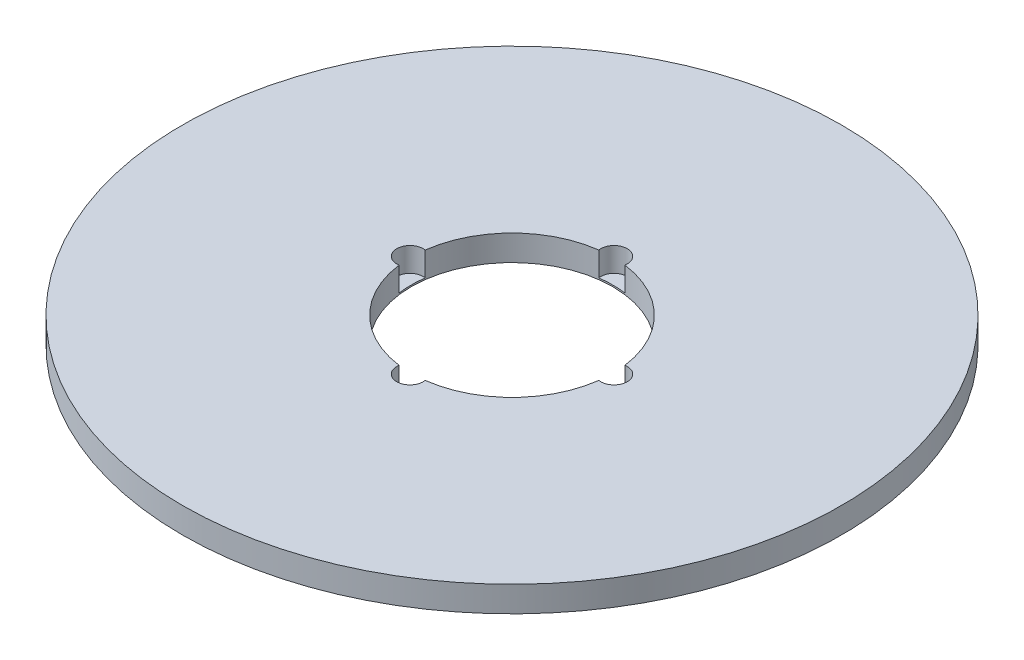
from build123d import *

# Parameters (mm, degrees)
SKETCH1_R           = 90
BOSS_EXTRUDE1_DEPTH = 7
SKETCH2_R           = 27.5
CUT_EXTRUDE1_DEPTH  = 128.471565457
SKETCH3_R           = 3.614044814
CUT_EXTRUDE2_DEPTH  = 6.584272471
CIRPATTERN1_COUNT   = 4


with BuildPart() as part:
    # Sketch1 → Boss-Extrude1 (new body)
    with BuildSketch(Plane(origin=(0, 0, 0), x_dir=(1, 0, 0), z_dir=(0, 1, 0))):
        Circle(SKETCH1_R)
    extrude(amount=BOSS_EXTRUDE1_DEPTH)

    # Sketch2 → Cut-Extrude1 (cut, through all)
    with BuildSketch(Plane(origin=(0, 0, 0), x_dir=(1, 0, 0), z_dir=(0, 1, 0))):
        Circle(SKETCH2_R)
    extrude(amount=CUT_EXTRUDE1_DEPTH, mode=Mode.SUBTRACT)

    # Sketch3 → Cut-Extrude2 (cut)
    with BuildSketch(Plane(origin=(0, 7, 0), x_dir=(1, 0, 0), z_dir=(0, 1, 0))):
        with Locations((-27.861501837, 0)):
            Circle(SKETCH3_R)
    cut_extrude2 = extrude(amount=-CUT_EXTRUDE2_DEPTH, mode=Mode.SUBTRACT)

    # CirPattern1: Cut-Extrude2 ×4 about axis
    cirpattern1_axis = Axis((0, 0, 0), (0, 1, 0))
    for i in range(1, CIRPATTERN1_COUNT):
        add(cut_extrude2.rotate(cirpattern1_axis, i * 360 / CIRPATTERN1_COUNT), mode=Mode.SUBTRACT)


solid = part.part
